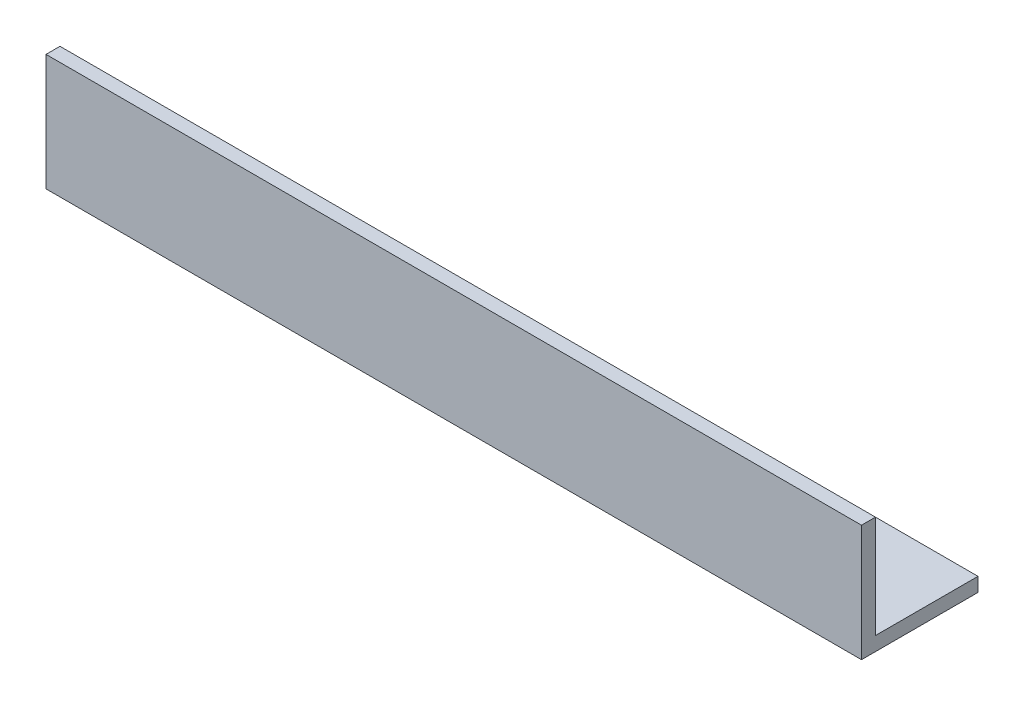
from build123d import *

# Parameters (mm, degrees)
EXTRUDE_2_DEPTH = 350


with BuildPart() as part:
    # Эскиз1 → Вытянуть-Тонкостенный2 (new body)
    with BuildSketch(Plane(origin=(0, 0, 0), x_dir=(0, 0, -1), z_dir=(1, 0, 0))):
        Polygon((0, 50), (0, 0), (50, 0), (50, 6), (6, 6), (6, 50), align=None)
    extrude(amount=EXTRUDE_2_DEPTH)


solid = part.part
